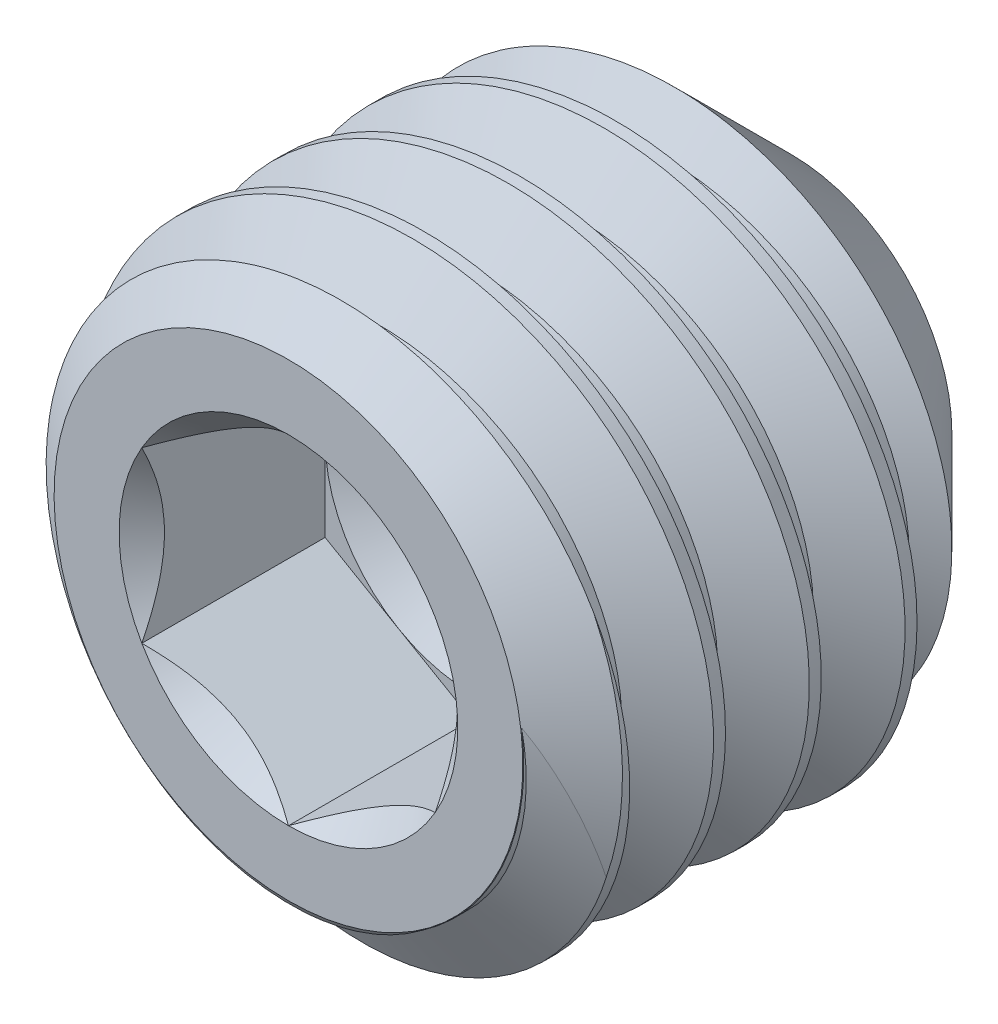
from build123d import *

# Parameters (mm, degrees)
CUT_SWEEP2_PITCH    = 1.814285714
CUT_EXTRUDE10_DEPTH = 3.47265625


with BuildPart() as part:
    # Sketch22 → Revolve1 (revolve)
    with BuildSketch(Plane(origin=(0, 0, 0), x_dir=(0, 0, -1), z_dir=(1, 0, 0)), mode=Mode.PRIVATE) as revolve1_sk:
        Polygon((-3.848846234, 0), (-3.848846234, 4.43992), (-3.071629871, 5.5499), (3.167404199, 5.5499), (5.676153766, 3.041150433), (3.848846234, 0), align=None)
    revolve(revolve1_sk.sketch.rotate(Axis((0, 0, -3.848846234), (0, 0, -1)), 180), axis=Axis((0, 0, -3.848846234), (0, 0, -1)))

    # Cut-Sweep2: arcs per turn and ends read off the stored shape
    # Cut-Sweep2: the profile of Sketch28 profile screwed along a right-hand helix through 6.972 turns, 10 arcs to a turn; built about Z, then put on its axis
    cut_sweep2_z = Axis((0, 0, 0), (0, 0, 1))
    cut_sweep2_corners = [(5.5502, 4.843e-06, -0.453397972), (5.5502, 4.843e-06, -2.041244382), (4.450047737, 3.883e-06, -1.406071177), (4.450047737, 3.883e-06, -1.088571177)]
    with BuildLine(mode=Mode.PRIVATE) as cut_sweep2_profile:
        Line(cut_sweep2_corners[0], cut_sweep2_corners[1])
        Line(cut_sweep2_corners[1], cut_sweep2_corners[2])
        Line(cut_sweep2_corners[2], cut_sweep2_corners[3])
        Line(cut_sweep2_corners[3], cut_sweep2_corners[0])
    cut_sweep2_cap = Face(cut_sweep2_profile.wire())
    cut_sweep2_turn_angles = [0, 18, 36, 54, 72, 90, 108, 126, 144, 162, 180, 198, 216, 234, 252, 270, 288, 306, 324, 342, 360]
    cut_sweep2_turn_weights = [1, 0.9510565162951535, 1, 0.9510565162951535, 1, 0.9510565162951535, 1, 0.9510565162951535, 1, 0.9510565162951535, 1, 0.9510565162951535, 1, 0.9510565162951535, 1, 0.9510565162951535, 1, 0.9510565162951535, 1, 0.9510565162951535, 1]
    cut_sweep2_turn_rails = [Edge.make_bspline([Vector(p[0], p[1], 0).rotate(cut_sweep2_z, cut_sweep2_turn_angles[k]) / cut_sweep2_turn_weights[k] + Vector(0, 0, p[2] + CUT_SWEEP2_PITCH * cut_sweep2_turn_angles[k] / 360) for k in range(21)], [0, 0, 0, 1, 1, 2, 2, 3, 3, 4, 4, 5, 5, 6, 6, 7, 7, 8, 8, 9, 9, 10, 10, 10], 2, cut_sweep2_turn_weights) for p in cut_sweep2_corners]
    cut_sweep2_turn_sides = [Face.make_surface_from_curves(cut_sweep2_turn_rails[p[0]], cut_sweep2_turn_rails[p[1]]) for p in [(0, 1), (1, 2), (2, 3), (3, 0)]]
    cut_sweep2_last_angles = [2160, 2178, 2196, 2214, 2232, 2250, 2268, 2286, 2304, 2322, 2340, 2358, 2376, 2394, 2412, 2430, 2448, 2466, 2484, 2496.96, 2509.92]
    cut_sweep2_last_weights = [1, 0.9510565162951535, 1, 0.9510565162951535, 1, 0.9510565162951535, 1, 0.9510565162951535, 1, 0.9510565162951535, 1, 0.9510565162951535, 1, 0.9510565162951535, 1, 0.9510565162951535, 1, 0.9510565162951535, 1, 0.9745268727865575, 1]
    cut_sweep2_last_rails = [Edge.make_bspline([Vector(p[0], p[1], 0).rotate(cut_sweep2_z, cut_sweep2_last_angles[k]) / cut_sweep2_last_weights[k] + Vector(0, 0, p[2] + CUT_SWEEP2_PITCH * cut_sweep2_last_angles[k] / 360) for k in range(21)], [0, 0, 0, 1, 1, 2, 2, 3, 3, 4, 4, 5, 5, 6, 6, 7, 7, 8, 8, 9, 9, 10, 10, 10], 2, cut_sweep2_last_weights) for p in cut_sweep2_corners]
    cut_sweep2_last_sides = [Face.make_surface_from_curves(cut_sweep2_last_rails[p[0]], cut_sweep2_last_rails[p[1]]) for p in [(0, 1), (1, 2), (2, 3), (3, 0)]]
    cut_sweep2 = Plane(origin=(0, 0, -5.676153766), x_dir=(1, 0, 0), z_dir=(0, 0, 1)) * Solid(Shell([*[p.moved(Location((0, 0, CUT_SWEEP2_PITCH * i))) for i in range(6) for p in cut_sweep2_turn_sides], *cut_sweep2_last_sides, cut_sweep2_cap, cut_sweep2_cap.rotate(cut_sweep2_z, 2509.92).moved(Location((0, 0, CUT_SWEEP2_PITCH * 2509.92 / 360)))]))
    add(cut_sweep2, mode=Mode.SUBTRACT)

    # Sketch23 → Cut-Extrude10 (cut)
    with BuildSketch(Plane.XY.offset(3.848846234)):
        Polygon((0, 3.207902433), (-2.778125, 1.603951217), (-2.778125, -1.603951217), (0, -3.207902433), (2.778125, -1.603951217), (2.778125, 1.603951217), align=None)
    extrude(amount=-CUT_EXTRUDE10_DEPTH, mode=Mode.SUBTRACT)

    # Cut-Extrude11 cone 1 section (through the dimple's axis) → Cut-Extrude11 (revolve, cut)
    with BuildSketch(Plane(origin=(0, 0, 3.848846234), x_dir=(0, -1, 0), z_dir=(1, 0, 0))):
        Polygon((0, 0), (3.207902433, 0), (0, 3.207902433), align=None)
    revolve(axis=Axis((0, 0, 3.848846234), (0, 0, -1)), mode=Mode.SUBTRACT)

    # Cut-Extrude12 cone 1 section (through the dimple's axis) → Cut-Extrude12 (revolve, cut)
    with BuildSketch(Plane(origin=(0, 0, 0.376189984), x_dir=(0, -1, 0), z_dir=(1, 0, 0))):
        Polygon((0, 0), (2.778125, 0), (0, 1.603951217), align=None)
    revolve(axis=Axis((0, 0, 0.376189984), (0, 0, -1)), mode=Mode.SUBTRACT)


solid = part.part
